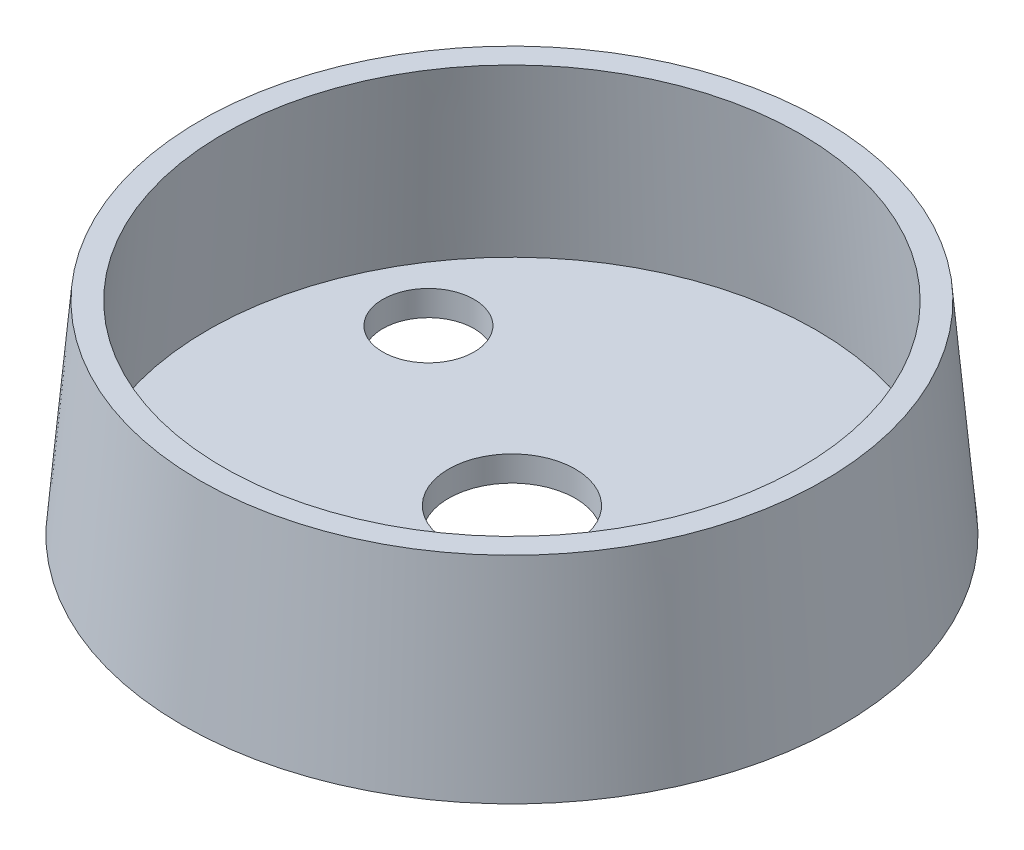
from build123d import *

# Parameters (mm, degrees)
SKETCH1_R           = 65
BOSS_EXTRUDE1_DEPTH = 40
BOSS_EXTRUDE1_TAPER = 5
CUT_EXTRUDE1_START  = -5
SKETCH2_R           = 60
CUT_EXTRUDE1_DEPTH  = 96.249688448
CUT_EXTRUDE1_DRAFT  = -5
SKETCH3_R           = 12.5
CUT_EXTRUDE2_DEPTH  = 21
SKETCH6_R           = 9
CUT_EXTRUDE3_DEPTH  = 21


with BuildPart() as part:
    # Sketch1 → Boss-Extrude1 (new body)
    with BuildSketch(Plane(origin=(0, 0, 0), x_dir=(1, 0, 0), z_dir=(0, 1, 0))):
        Circle(SKETCH1_R)
    extrude(amount=BOSS_EXTRUDE1_DEPTH, taper=BOSS_EXTRUDE1_TAPER)


with BuildPart() as cut_extrude1_tool:
    # Sketch2 → Cut-Extrude1 (with draft: the straight prism first)
    with BuildSketch(Plane.XZ.offset(CUT_EXTRUDE1_START)):
        Circle(SKETCH2_R)
    extrude(amount=-CUT_EXTRUDE1_DEPTH)
    # Cut-Extrude1: the draft: its side faces are tilted about the plane it starts from
    cut_extrude1_sides = [cut_extrude1_tool.faces().sort_by_distance(p)[0] for p in [
        (-60, 53.124844224, 0),
    ]]
    draft(cut_extrude1_sides, Plane.XZ.offset(CUT_EXTRUDE1_START), CUT_EXTRUDE1_DRAFT)


with BuildPart() as part_1:
    add(part.part)

    # Cut-Extrude1: cut by cut_extrude1_tool
    add(cut_extrude1_tool.part, mode=Mode.SUBTRACT)

    # Sketch3 → Cut-Extrude2 (cut)
    with BuildSketch(Plane.XZ):
        Circle(SKETCH3_R)
    extrude(amount=-CUT_EXTRUDE2_DEPTH, mode=Mode.SUBTRACT)

    # Sketch6 → Cut-Extrude3 (cut)
    with BuildSketch(Plane.XZ):
        with Locations((0, 45)):
            Circle(SKETCH6_R)
        with Locations((-38.97114317, -22.5)):
            Circle(SKETCH6_R)
        with Locations((38.97114317, -22.5)):
            Circle(SKETCH6_R)
    extrude(amount=-CUT_EXTRUDE3_DEPTH, mode=Mode.SUBTRACT)


solid = part_1.part
